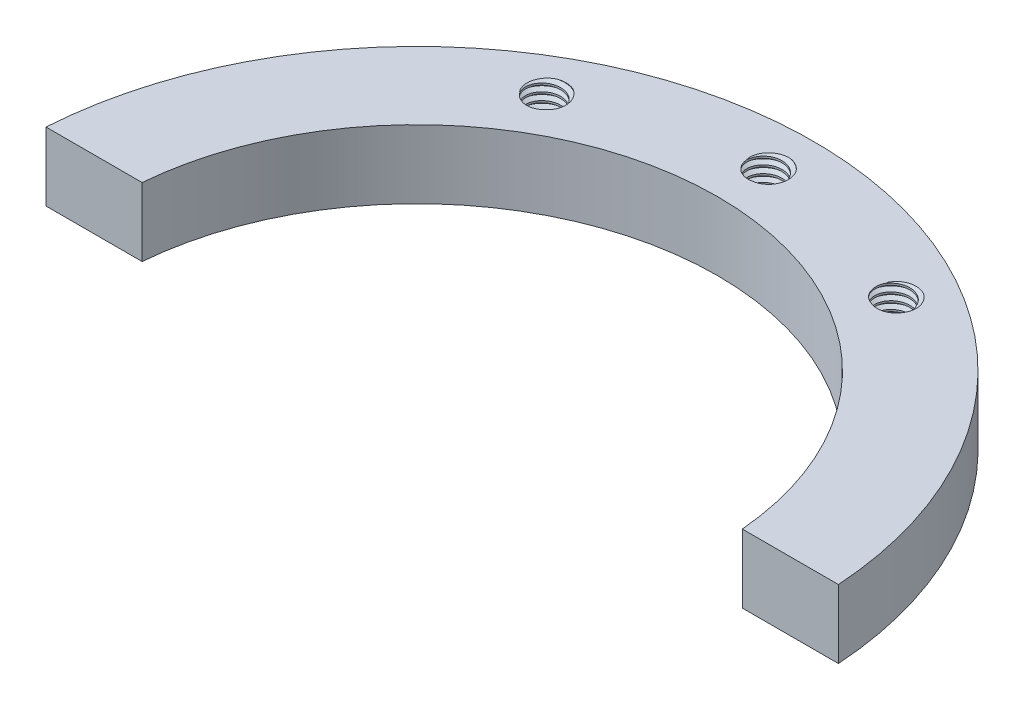
from build123d import *

# Parameters (mm, degrees)
SKETCH1_R                       = 73.66
SKETCH1_R_2                     = 55.88
BOSS_EXTRUDE1_DEPTH             = 12.7
CUT_EXTRUDE1_REACH              = 106.942
SKETCH3_W                       = 174.179431321
SKETCH3_H                       = 95.128766337
F_5_16_18_TAPPED_HOLE1_D        = 6.5278
THREAD1_PITCH                   = 1.411111111
CIRPATTERN1_COUNT               = 2
CIRPATTERN1_ANGLE               = 30
CIRPATTERN1_THE_OTHER_WAY_COUNT = 2
CIRPATTERN1_THE_OTHER_WAY_ANGLE = 30


with BuildPart() as part:
    # Sketch1 → Boss-Extrude1 (new body)
    with BuildSketch(Plane(origin=(0, 0, 0), x_dir=(1, 0, 0), z_dir=(0, 1, 0))):
        with Locations(Location((0, 0, 0), (0, 0, 270))):
            Circle(SKETCH1_R)
        with Locations(Location((0, 0, 0), (0, 0, 270))):
            Circle(SKETCH1_R_2, mode=Mode.SUBTRACT)
    extrude(amount=BOSS_EXTRUDE1_DEPTH)

    # Sketch3 → Cut-Extrude1 (cut, up to next)
    with BuildSketch(Plane(origin=(0, 12.7, 0), x_dir=(1, 0, 0), z_dir=(0, 1, 0)), mode=Mode.PRIVATE) as cut_extrude1_sk1:
        with Locations((-0.022555156, -42.801883168)):
            Rectangle(SKETCH3_W, SKETCH3_H)
    cut_extrude1_tool1 = extrude(cut_extrude1_sk1.sketch, amount=-CUT_EXTRUDE1_REACH, mode=Mode.PRIVATE) & part.part
    add(cut_extrude1_tool1.solids().sort_by_distance((-0.022555, 12.7, 42.801883))[0], mode=Mode.SUBTRACT)

    # 5/16-18 Tapped Hole1 (through all)
    with Locations(Plane(origin=(0, 12.7, -64.77), x_dir=(0, 0, 1), z_dir=(0, 1, 0))):
        with Locations((0, 0)):
            f_5_16_18_tapped_hole1 = Hole(F_5_16_18_TAPPED_HOLE1_D / 2)

    # Thread1: the profile of Thread Profile1 profile screwed along a right-hand helix of 14.173228 turns, 8 arcs to a turn; built about Z, then put on its axis
    thread1_z = Axis((0, 0, 0), (0, 0, 1))
    thread1_corners = [(3.2636, 0, -0.000173205), (4.02768629, 0, 0.44097222), (4.02768629, 0, 0.617361109), (3.2636, 0, 1.058506535)]
    with BuildLine(mode=Mode.PRIVATE) as thread1_profile:
        Line(thread1_corners[0], thread1_corners[1])
        Line(thread1_corners[1], thread1_corners[2])
        Line(thread1_corners[2], thread1_corners[3])
        Line(thread1_corners[3], thread1_corners[0])
    thread1_cap = Face(thread1_profile.wire())
    thread1_turn_angles = [0, 22.5, 45, 67.5, 90, 112.5, 135, 157.5, 180, 202.5, 225, 247.5, 270, 292.5, 315, 337.5, 360]
    thread1_turn_weights = [1, 0.9238795325112867, 1, 0.9238795325112867, 1, 0.9238795325112867, 1, 0.9238795325112867, 1, 0.9238795325112867, 1, 0.9238795325112867, 1, 0.9238795325112867, 1, 0.9238795325112867, 1]
    thread1_turn_rails = [Edge.make_bspline([Vector(p[0], p[1], 0).rotate(thread1_z, thread1_turn_angles[k]) / thread1_turn_weights[k] + Vector(0, 0, p[2] + THREAD1_PITCH * thread1_turn_angles[k] / 360) for k in range(17)], [0, 0, 0, 1, 1, 2, 2, 3, 3, 4, 4, 5, 5, 6, 6, 7, 7, 8, 8, 8], 2, thread1_turn_weights) for p in thread1_corners]
    thread1_turn_sides = [Face.make_surface_from_curves(thread1_turn_rails[p[0]], thread1_turn_rails[p[1]]) for p in [(0, 1), (1, 2), (2, 3), (3, 0)]]
    thread1_last_angles = [5040, 5062.5, 5085, 5093.681102362, 5102.362204724]
    thread1_last_weights = [1, 0.9238795325112867, 1, 0.9885437227923869, 1]
    thread1_last_rails = [Edge.make_bspline([Vector(p[0], p[1], 0).rotate(thread1_z, thread1_last_angles[k]) / thread1_last_weights[k] + Vector(0, 0, p[2] + THREAD1_PITCH * thread1_last_angles[k] / 360) for k in range(5)], [0, 0, 0, 1, 1, 2, 2, 2], 2, thread1_last_weights) for p in thread1_corners]
    thread1_last_sides = [Face.make_surface_from_curves(thread1_last_rails[p[0]], thread1_last_rails[p[1]]) for p in [(0, 1), (1, 2), (2, 3), (3, 0)]]
    thread1 = Plane(origin=(0, 13.7, -64.77), x_dir=(-1, 0, 0), z_dir=(0, -1, 0)) * Solid(Shell([*[p.moved(Location((0, 0, THREAD1_PITCH * i))) for i in range(14) for p in thread1_turn_sides], *thread1_last_sides, thread1_cap, thread1_cap.rotate(thread1_z, 5102.362204724).moved(Location((0, 0, THREAD1_PITCH * 5102.362204724 / 360)))]))
    add(thread1, mode=Mode.SUBTRACT)

    # CirPattern1: 5/16-18 Tapped Hole1, Thread1 ×2 about axis
    cirpattern1_axis = Axis((0, 12.7, 0), (0, -1, 0))
    add([f_5_16_18_tapped_hole1.rotate(cirpattern1_axis, i * CIRPATTERN1_ANGLE / (CIRPATTERN1_COUNT - 1)) for i in range(1, CIRPATTERN1_COUNT)], mode=Mode.SUBTRACT)
    add([thread1.rotate(cirpattern1_axis, i * CIRPATTERN1_ANGLE / (CIRPATTERN1_COUNT - 1)) for i in range(1, CIRPATTERN1_COUNT)], mode=Mode.SUBTRACT)

    # CirPattern1 the other way: 5/16-18 Tapped Hole1, Thread1 ×2 about axis
    cirpattern1_the_other_way_axis = Axis((0, 12.7, 0), (0, 1, 0))
    add([f_5_16_18_tapped_hole1.rotate(cirpattern1_the_other_way_axis, i * CIRPATTERN1_THE_OTHER_WAY_ANGLE / (CIRPATTERN1_THE_OTHER_WAY_COUNT - 1)) for i in range(1, CIRPATTERN1_THE_OTHER_WAY_COUNT)], mode=Mode.SUBTRACT)
    add([thread1.rotate(cirpattern1_the_other_way_axis, i * CIRPATTERN1_THE_OTHER_WAY_ANGLE / (CIRPATTERN1_THE_OTHER_WAY_COUNT - 1)) for i in range(1, CIRPATTERN1_THE_OTHER_WAY_COUNT)], mode=Mode.SUBTRACT)


solid = part.part
